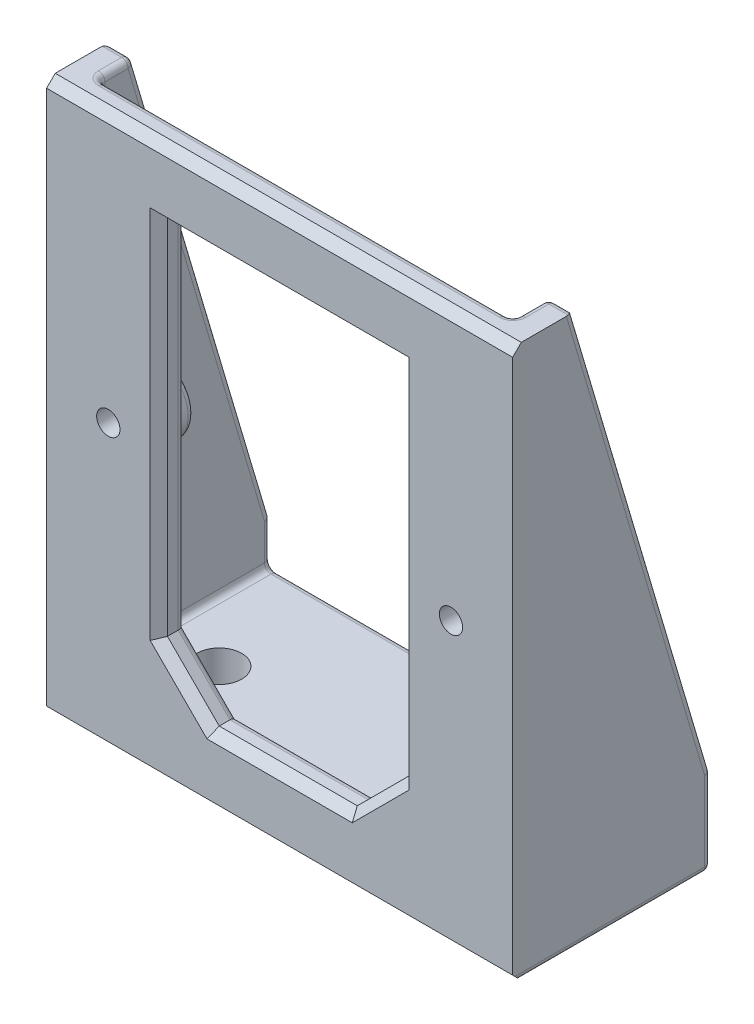
from build123d import *

# Parameters (mm, degrees)
SKETCH1_W           = 54
SKETCH1_H           = 64
SKETCH1_R           = 1.35
BOSS_EXTRUDE1_DEPTH = 3
BOSS_EXTRUDE2_DEPTH = 3
BOSS_EXTRUDE3_DEPTH = 3
CUT_EXTRUDE2_START  = -3
SKETCH4_R           = 1.35
CUT_EXTRUDE2_DEPTH  = 3
SKETCH5_W           = 48
SKETCH5_H           = 20
SKETCH5_R           = 2.6
BOSS_EXTRUDE4_DEPTH = 5
FILLET3_R           = 0.75
CHAMFER1_SIZE       = 1


with BuildPart() as part:
    # Sketch1 → Boss-Extrude1 (new body)
    with BuildSketch(Plane.XY):
        with Locations((0, 32)):
            Rectangle(SKETCH1_W, SKETCH1_H)
        with Locations((-19.85, 33)):
            Circle(SKETCH1_R, mode=Mode.SUBTRACT)
        with Locations((19.85, 33)):
            Circle(SKETCH1_R, mode=Mode.SUBTRACT)
        Polygon((-8, 8), (8, 8), (14, 14), (14, 56), (-14, 56), (-14, 14), align=None, mode=Mode.SUBTRACT)
    extrude(amount=BOSS_EXTRUDE1_DEPTH)

    # Sketch2 → Boss-Extrude2 (add)
    with BuildSketch(Plane(origin=(27, 0, 0), x_dir=(0, 0, -1), z_dir=(1, 0, 0))):
        Polygon((0, 64), (0, 0), (20, 0), (20, 10), (4, 64), align=None)
    boss_extrude2 = extrude(amount=-BOSS_EXTRUDE2_DEPTH)

    # Mirror1: Boss-Extrude2 across plane
    add(boss_extrude2.mirror(Plane(origin=(0, 0, 0), x_dir=(0, 0, 1), z_dir=(1, 0, 0))))

    # Sketch3 → Boss-Extrude3 (add)
    with BuildSketch(Plane(origin=(0, 0, 0), x_dir=(-1, 0, 0), z_dir=(0, 0, -1))):
        with BuildLine():
            Line((-19.85, 37), (-24, 37))
            Line((-24, 37), (-24, 29))
            Line((-24, 29), (-19.85, 29))
            ThreePointArc((-19.85, 29), (-15.85, 33), (-19.85, 37))
        make_face()
        with BuildLine():
            Line((24, 29), (24, 37))
            Line((24, 37), (19.85, 37))
            ThreePointArc((19.85, 37), (15.85, 33), (19.85, 29))
            Line((19.85, 29), (24, 29))
        make_face()
    extrude(amount=BOSS_EXTRUDE3_DEPTH)

    # Sketch4 → Cut-Extrude2 (cut)
    with BuildSketch(Plane.XY.offset(CUT_EXTRUDE2_START)):
        with Locations(Location((-19.85, 33, 0), (0, 0, 180))):
            Circle(SKETCH4_R)
        with Locations(Location((19.85, 33, 0), (0, 0, 180))):
            Circle(SKETCH4_R)
    extrude(amount=CUT_EXTRUDE2_DEPTH, mode=Mode.SUBTRACT)

    # Sketch5 → Boss-Extrude4 (add)
    with BuildSketch(Plane.XZ):
        with Locations((0, -10)):
            Rectangle(SKETCH5_W, SKETCH5_H)
        with Locations((-17, -7)):
            Circle(SKETCH5_R, mode=Mode.SUBTRACT)
        with Locations((17, -7)):
            Circle(SKETCH5_R, mode=Mode.SUBTRACT)
    extrude(amount=-BOSS_EXTRUDE4_DEPTH)

    # Fillet3
    fillet3_edges = [part.edges().sort_by_distance(p)[0] for p in [
        (-24, 7.5, -20),
        (24, 7.5, -20),
        (24, 5, -10),
        (0, 5, -20),
        (-24, 5, -10),
        (-11, 11, 0),
        (0, 8, 0),
        (11, 11, 0),
        (14, 35, 0),
        (0, 56, 0),
        (-14, 35, 0),
        (0, 64, 0),
        (24, 64, -2),
        (24, 37, -12),
        (25.5, 64, -4),
        (25.5, 10, -20),
        (0, 0, -20),
        (24, 50.5, 0),
        (27, 5, -20),
        (27, 37, -12),
        (-25.5, 64, -4),
        (-27, 5, -20),
        (-27, 37, -12),
        (-25.5, 10, -20),
        (-24, 64, -2),
        (-24, 50.5, 0),
        (-24, 37, -12),
        (24, 17, 0),
        (27, 0, -8.5),
        (-27, 0, -8.5),
        (15.85, 33, 0),
        (21.925, 37, 0),
        (24, 37, -1.5),
        (21.925, 29, 0),
        (24, 29, -1.5),
        (15.85, 33, -3),
        (21.925, 37, -3),
        (24, 33, -3),
        (21.925, 29, -3),
        (-24, 17, 0),
        (-15.85, 33, 0),
        (-21.925, 29, 0),
        (-24, 29, -1.5),
        (-21.925, 37, 0),
        (-24, 37, -1.5),
        (-15.85, 33, -3),
        (-21.925, 29, -3),
        (-24, 33, -3),
        (-21.925, 37, -3),
    ]]
    fillet(fillet3_edges, radius=FILLET3_R)

    # Chamfer1
    # the kernel refuses this chamfer: 1 mm, written as the material it takes off along each edge
    with BuildSketch(Plane(origin=(29.571682988, 64, 3), x_dir=(0, -0.9996219169112968, 0.027495876610586414), z_dir=(-1, 0, 0))) as chamfer1_piece_1:
        Polygon((CHAMFER1_SIZE * 0.999621916911, -CHAMFER1_SIZE * 0.0274958766106), (-CHAMFER1_SIZE * 0.0274958766106, -CHAMFER1_SIZE * 0.999621916911), (0, 0), align=None)
    extrude(amount=59.143365976, mode=Mode.SUBTRACT)
    with BuildSketch(Plane(origin=(-28.821682988, 0, 3), x_dir=(0, -0.027495876610586382, -0.9996219169112968), z_dir=(1, 0, 0))) as chamfer1_piece_2:
        Polygon((CHAMFER1_SIZE * 0.999621916911, CHAMFER1_SIZE * 0.0274958766106), (-CHAMFER1_SIZE * 0.0274958766106, CHAMFER1_SIZE * 0.999621916911), (0, 0), align=None)
    extrude(amount=57.643365976, mode=Mode.SUBTRACT)
    with BuildSketch(Plane(origin=(-15.81845448, 15.81845448, 3), x_dir=(-0.7068394360706732, -0.7068394360706739, 0.027495876610586528), z_dir=(0.7071067811865478, -0.7071067811865472, 0))) as chamfer1_piece_3_section:
        Polygon((CHAMFER1_SIZE * 0.999621916911, CHAMFER1_SIZE * 0.0274958766106), (-CHAMFER1_SIZE * 0.0274958766106, CHAMFER1_SIZE * 0.999621916911), (0, 0), align=None)
    chamfer1_piece_3 = extrude(amount=13.62864735, mode=Mode.PRIVATE)
    chamfer1_piece_3 = split(chamfer1_piece_3, bisect_by=Plane(origin=(-14, 10.778276497, 2.66153015), z_dir=(1, 0, 0)), keep=Keep.TOP, mode=Mode.PRIVATE)
    chamfer1_piece_3 = split(chamfer1_piece_3, bisect_by=Plane(origin=(-11.221723503, 8, 2.66153015), z_dir=(0, 1, 0)), keep=Keep.TOP, mode=Mode.PRIVATE)
    add(chamfer1_piece_3, mode=Mode.SUBTRACT)
    with BuildSketch(Plane(origin=(-10.571682988, 8, 3), x_dir=(0, -0.9996219169112968, 0.027495876610586487), z_dir=(1, 0, 0))) as chamfer1_piece_4_section:
        Polygon((CHAMFER1_SIZE * 0.999621916911, CHAMFER1_SIZE * 0.0274958766106), (-CHAMFER1_SIZE * 0.0274958766106, CHAMFER1_SIZE * 0.999621916911), (0, 0), align=None)
    chamfer1_piece_4 = extrude(amount=21.143365976, mode=Mode.PRIVATE)
    chamfer1_piece_4 = split(chamfer1_piece_4, bisect_by=Plane(origin=(-3.839242746, 3.839242746, 2.665780321), z_dir=(0.7071067811865472, 0.7071067811865478, 0)), keep=Keep.TOP, mode=Mode.PRIVATE)
    chamfer1_piece_4 = split(chamfer1_piece_4, bisect_by=Plane(origin=(3.839242746, 3.839242746, 2.665780321), z_dir=(-0.7071067811865474, 0.7071067811865477, 0)), keep=Keep.TOP, mode=Mode.PRIVATE)
    add(chamfer1_piece_4, mode=Mode.SUBTRACT)
    with BuildSketch(Plane(origin=(6.18154552, 6.18154552, 3), x_dir=(0.7068394360706733, -0.7068394360706738, 0.027495876610586546), z_dir=(0.7071067811865477, 0.7071067811865474, 0))) as chamfer1_piece_5_section:
        Polygon((CHAMFER1_SIZE * 0.999621916911, CHAMFER1_SIZE * 0.0274958766106), (-CHAMFER1_SIZE * 0.0274958766106, CHAMFER1_SIZE * 0.999621916911), (0, 0), align=None)
    chamfer1_piece_5 = extrude(amount=13.62864735, mode=Mode.PRIVATE)
    chamfer1_piece_5 = split(chamfer1_piece_5, bisect_by=Plane(origin=(14, 10.778276497, 2.66153015), z_dir=(-1, 0, 0)), keep=Keep.TOP, mode=Mode.PRIVATE)
    chamfer1_piece_5 = split(chamfer1_piece_5, bisect_by=Plane(origin=(11.221723503, 8, 2.66153015), z_dir=(0, 1, 0)), keep=Keep.TOP, mode=Mode.PRIVATE)
    add(chamfer1_piece_5, mode=Mode.SUBTRACT)
    with BuildSketch(Plane(origin=(14, 11.428317012, 3), x_dir=(0.9996219169112968, 0, 0.02749587661058651), z_dir=(0, 1, 0))) as chamfer1_piece_6_section:
        Polygon((CHAMFER1_SIZE * 0.999621916911, CHAMFER1_SIZE * 0.0274958766106), (-CHAMFER1_SIZE * 0.0274958766106, CHAMFER1_SIZE * 0.999621916911), (0, 0), align=None)
    chamfer1_piece_6 = extrude(amount=44.571682988, mode=Mode.PRIVATE)
    chamfer1_piece_6 = split(chamfer1_piece_6, bisect_by=Plane(origin=(24.746202271, 24.746202271, 2.669391673), z_dir=(-0.7071067811865474, 0.7071067811865477, 0)), keep=Keep.TOP, mode=Mode.PRIVATE)
    add(chamfer1_piece_6, mode=Mode.SUBTRACT)
    with BuildSketch(Plane(origin=(14, 56, 3), x_dir=(0, 0.9996219169112968, 0.027495876610586414), z_dir=(-1, 0, 0))) as chamfer1_piece_7:
        Polygon((CHAMFER1_SIZE * 0.999621916911, CHAMFER1_SIZE * 0.0274958766106), (-CHAMFER1_SIZE * 0.0274958766106, CHAMFER1_SIZE * 0.999621916911), (0, 0), align=None)
    extrude(amount=28, mode=Mode.SUBTRACT)
    with BuildSketch(Plane(origin=(-14, 56, 3), x_dir=(-0.9996219169112968, 0, 0.02749587661058651), z_dir=(0, -1, 0))) as chamfer1_piece_8_section:
        Polygon((CHAMFER1_SIZE * 0.999621916911, CHAMFER1_SIZE * 0.0274958766106), (-CHAMFER1_SIZE * 0.0274958766106, CHAMFER1_SIZE * 0.999621916911), (0, 0), align=None)
    chamfer1_piece_8 = extrude(amount=44.571682988, mode=Mode.PRIVATE)
    chamfer1_piece_8 = split(chamfer1_piece_8, bisect_by=Plane(origin=(-24.746202271, 24.746202271, 2.669391673), z_dir=(0.7071067811865472, 0.7071067811865478, 0)), keep=Keep.TOP, mode=Mode.PRIVATE)
    add(chamfer1_piece_8, mode=Mode.SUBTRACT)
    with BuildSketch(Plane(origin=(-15.81845448, 15.81845448, 3), x_dir=(-0.7068394360706732, -0.7068394360706739, 0.027495876610586528), z_dir=(0.7071067811865478, -0.7071067811865472, 0))) as chamfer1_piece_9a_section:
        Polygon((CHAMFER1_SIZE * 0.999621916911, CHAMFER1_SIZE * 0.0274958766106), (-CHAMFER1_SIZE * 0.0274958766106, CHAMFER1_SIZE * 0.999621916911), (0, 0), align=None)
    chamfer1_piece_9a = extrude(amount=13.62864735, mode=Mode.PRIVATE)
    chamfer1_piece_9a = split(chamfer1_piece_9a, bisect_by=Plane(origin=(-14, 14.536214365, 2.681906875), z_dir=(-1, 0, 0)), keep=Keep.TOP, mode=Mode.PRIVATE)
    with BuildSketch(Plane(origin=(-14, 56, 3), x_dir=(-0.9996219169112968, 0, 0.02749587661058651), z_dir=(0, -1, 0))) as chamfer1_piece_9b_section:
        Polygon((CHAMFER1_SIZE * 0.999621916911, CHAMFER1_SIZE * 0.0274958766106), (-CHAMFER1_SIZE * 0.0274958766106, CHAMFER1_SIZE * 0.999621916911), (0, 0), align=None)
    chamfer1_piece_9b = extrude(amount=44.571682988, mode=Mode.PRIVATE)
    chamfer1_piece_9b = split(chamfer1_piece_9b, bisect_by=Plane(origin=(-13.620839187, 13.620839187, 2.681906875), z_dir=(-0.7071067811865472, -0.7071067811865478, 0)), keep=Keep.TOP, mode=Mode.PRIVATE)
    chamfer1_piece_9 = chamfer1_piece_9a & chamfer1_piece_9b
    add(chamfer1_piece_9, mode=Mode.SUBTRACT)
    with BuildSketch(Plane(origin=(-15.81845448, 15.81845448, 3), x_dir=(-0.7068394360706732, -0.7068394360706739, 0.027495876610586528), z_dir=(0.7071067811865478, -0.7071067811865472, 0))) as chamfer1_piece_10a_section:
        Polygon((CHAMFER1_SIZE * 0.999621916911, CHAMFER1_SIZE * 0.0274958766106), (-CHAMFER1_SIZE * 0.0274958766106, CHAMFER1_SIZE * 0.999621916911), (0, 0), align=None)
    chamfer1_piece_10a = extrude(amount=13.62864735, mode=Mode.PRIVATE)
    chamfer1_piece_10a = split(chamfer1_piece_10a, bisect_by=Plane(origin=(-7.463785635, 8, 2.681906875), z_dir=(0, -1, 0)), keep=Keep.TOP, mode=Mode.PRIVATE)
    with BuildSketch(Plane(origin=(-10.571682988, 8, 3), x_dir=(0, -0.9996219169112968, 0.027495876610586487), z_dir=(1, 0, 0))) as chamfer1_piece_10b_section:
        Polygon((CHAMFER1_SIZE * 0.999621916911, CHAMFER1_SIZE * 0.0274958766106), (-CHAMFER1_SIZE * 0.0274958766106, CHAMFER1_SIZE * 0.999621916911), (0, 0), align=None)
    chamfer1_piece_10b = extrude(amount=21.143365976, mode=Mode.PRIVATE)
    chamfer1_piece_10b = split(chamfer1_piece_10b, bisect_by=Plane(origin=(-8.379160813, 8.379160813, 2.681906875), z_dir=(-0.7071067811865472, -0.7071067811865478, 0)), keep=Keep.TOP, mode=Mode.PRIVATE)
    chamfer1_piece_10 = chamfer1_piece_10a & chamfer1_piece_10b
    add(chamfer1_piece_10, mode=Mode.SUBTRACT)
    with BuildSketch(Plane(origin=(6.18154552, 6.18154552, 3), x_dir=(0.7068394360706733, -0.7068394360706738, 0.027495876610586546), z_dir=(0.7071067811865477, 0.7071067811865474, 0))) as chamfer1_piece_11a_section:
        Polygon((CHAMFER1_SIZE * 0.999621916911, CHAMFER1_SIZE * 0.0274958766106), (-CHAMFER1_SIZE * 0.0274958766106, CHAMFER1_SIZE * 0.999621916911), (0, 0), align=None)
    chamfer1_piece_11a = extrude(amount=13.62864735, mode=Mode.PRIVATE)
    chamfer1_piece_11a = split(chamfer1_piece_11a, bisect_by=Plane(origin=(7.463785635, 8, 2.681906875), z_dir=(0, -1, 0)), keep=Keep.TOP, mode=Mode.PRIVATE)
    with BuildSketch(Plane(origin=(-10.571682988, 8, 3), x_dir=(0, -0.9996219169112968, 0.027495876610586487), z_dir=(1, 0, 0))) as chamfer1_piece_11b_section:
        Polygon((CHAMFER1_SIZE * 0.999621916911, CHAMFER1_SIZE * 0.0274958766106), (-CHAMFER1_SIZE * 0.0274958766106, CHAMFER1_SIZE * 0.999621916911), (0, 0), align=None)
    chamfer1_piece_11b = extrude(amount=21.143365976, mode=Mode.PRIVATE)
    chamfer1_piece_11b = split(chamfer1_piece_11b, bisect_by=Plane(origin=(8.379160813, 8.379160813, 2.681906875), z_dir=(0.7071067811865474, -0.7071067811865477, 0)), keep=Keep.TOP, mode=Mode.PRIVATE)
    chamfer1_piece_11 = chamfer1_piece_11a & chamfer1_piece_11b
    add(chamfer1_piece_11, mode=Mode.SUBTRACT)
    with BuildSketch(Plane(origin=(14, 11.428317012, 3), x_dir=(0.9996219169112968, 0, 0.02749587661058651), z_dir=(0, 1, 0))) as chamfer1_piece_12a_section:
        Polygon((CHAMFER1_SIZE * 0.999621916911, CHAMFER1_SIZE * 0.0274958766106), (-CHAMFER1_SIZE * 0.0274958766106, CHAMFER1_SIZE * 0.999621916911), (0, 0), align=None)
    chamfer1_piece_12a = extrude(amount=44.571682988, mode=Mode.PRIVATE)
    chamfer1_piece_12a = split(chamfer1_piece_12a, bisect_by=Plane(origin=(13.620839187, 13.620839187, 2.681906875), z_dir=(0.7071067811865474, -0.7071067811865477, 0)), keep=Keep.TOP, mode=Mode.PRIVATE)
    with BuildSketch(Plane(origin=(6.18154552, 6.18154552, 3), x_dir=(0.7068394360706733, -0.7068394360706738, 0.027495876610586546), z_dir=(0.7071067811865477, 0.7071067811865474, 0))) as chamfer1_piece_12b_section:
        Polygon((CHAMFER1_SIZE * 0.999621916911, CHAMFER1_SIZE * 0.0274958766106), (-CHAMFER1_SIZE * 0.0274958766106, CHAMFER1_SIZE * 0.999621916911), (0, 0), align=None)
    chamfer1_piece_12b = extrude(amount=13.62864735, mode=Mode.PRIVATE)
    chamfer1_piece_12b = split(chamfer1_piece_12b, bisect_by=Plane(origin=(14, 14.536214365, 2.681906875), z_dir=(1, 0, 0)), keep=Keep.TOP, mode=Mode.PRIVATE)
    chamfer1_piece_12 = chamfer1_piece_12a & chamfer1_piece_12b
    add(chamfer1_piece_12, mode=Mode.SUBTRACT)
    with BuildSketch(Plane(origin=(16.571682988, 56, 3), x_dir=(0, 0.9996219169112968, 0.027495876610586414), z_dir=(-1, 0, 0))) as chamfer1_piece_13a_section:
        Polygon((CHAMFER1_SIZE * 0.999621916911, CHAMFER1_SIZE * 0.0274958766106), (-CHAMFER1_SIZE * 0.0274958766106, CHAMFER1_SIZE * 0.999621916911), (0, 0), align=None)
    chamfer1_piece_13a = extrude(amount=30.571682988, mode=Mode.PRIVATE)
    chamfer1_piece_13a = split(chamfer1_piece_13a, bisect_by=Plane(origin=(14, 56.329793627, 2.670206373), z_dir=(1, 0, 0)), keep=Keep.TOP, mode=Mode.PRIVATE)
    with BuildSketch(Plane(origin=(14, 11.428317012, 3), x_dir=(0.9996219169112968, 0, 0.02749587661058651), z_dir=(0, 1, 0))) as chamfer1_piece_13b_section:
        Polygon((CHAMFER1_SIZE * 0.999621916911, CHAMFER1_SIZE * 0.0274958766106), (-CHAMFER1_SIZE * 0.0274958766106, CHAMFER1_SIZE * 0.999621916911), (0, 0), align=None)
    chamfer1_piece_13b = extrude(amount=47.143365976, mode=Mode.PRIVATE)
    chamfer1_piece_13b = split(chamfer1_piece_13b, bisect_by=Plane(origin=(14.329793627, 56, 2.670206373), z_dir=(0, 1, 0)), keep=Keep.TOP, mode=Mode.PRIVATE)
    chamfer1_piece_13 = chamfer1_piece_13a & chamfer1_piece_13b
    add(chamfer1_piece_13, mode=Mode.SUBTRACT)
    with BuildSketch(Plane(origin=(-14, 58.571682988, 3), x_dir=(-0.9996219169112968, 0, 0.02749587661058651), z_dir=(0, -1, 0))) as chamfer1_piece_14a_section:
        Polygon((CHAMFER1_SIZE * 0.999621916911, CHAMFER1_SIZE * 0.0274958766106), (-CHAMFER1_SIZE * 0.0274958766106, CHAMFER1_SIZE * 0.999621916911), (0, 0), align=None)
    chamfer1_piece_14a = extrude(amount=47.143365976, mode=Mode.PRIVATE)
    chamfer1_piece_14a = split(chamfer1_piece_14a, bisect_by=Plane(origin=(-14.329793627, 56, 2.670206373), z_dir=(0, 1, 0)), keep=Keep.TOP, mode=Mode.PRIVATE)
    with BuildSketch(Plane(origin=(14, 56, 3), x_dir=(0, 0.9996219169112968, 0.027495876610586414), z_dir=(-1, 0, 0))) as chamfer1_piece_14b_section:
        Polygon((CHAMFER1_SIZE * 0.999621916911, CHAMFER1_SIZE * 0.0274958766106), (-CHAMFER1_SIZE * 0.0274958766106, CHAMFER1_SIZE * 0.999621916911), (0, 0), align=None)
    chamfer1_piece_14b = extrude(amount=30.571682988, mode=Mode.PRIVATE)
    chamfer1_piece_14b = split(chamfer1_piece_14b, bisect_by=Plane(origin=(-14, 56.329793627, 2.670206373), z_dir=(-1, 0, 0)), keep=Keep.TOP, mode=Mode.PRIVATE)
    chamfer1_piece_14 = chamfer1_piece_14a & chamfer1_piece_14b
    add(chamfer1_piece_14, mode=Mode.SUBTRACT)


solid = part.part
